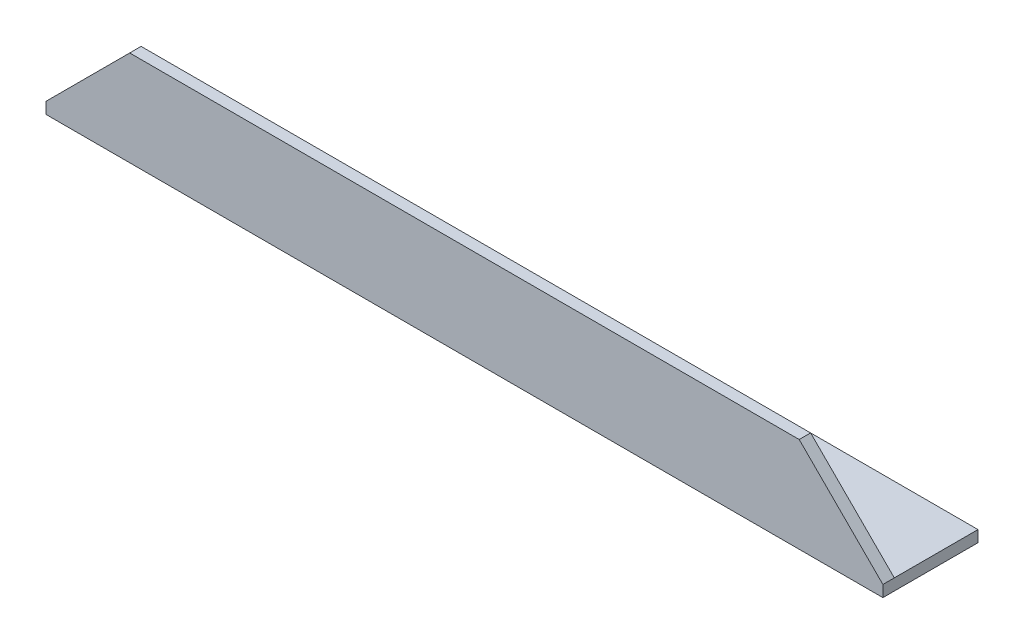
from build123d import *

# Parameters (mm, degrees)
EXTRUDE_1_DEPTH     = 220
SKETCH_2_OUTSIDE_W  = 266.564
SKETCH_2_OUTSIDE_H  = 71.564
CUT_EXTRUDE_1_DEPTH = 220


with BuildPart() as part:
    # Эскиз1 → Бобышка-Вытянуть1 (new body)
    with BuildSketch(Plane(origin=(0, 0, 0), x_dir=(0, 0, -1), z_dir=(1, 0, 0))):
        Polygon((0, 25), (0, 0), (25, 0), (25, 3), (3, 3), (3, 25), align=None)
    extrude(amount=EXTRUDE_1_DEPTH)

    # Эскиз2 outside → Вырез-Вытянуть1 (cut)
    with BuildSketch(Plane.XY):
        with Locations((110, 12.5)):
            Rectangle(SKETCH_2_OUTSIDE_W, SKETCH_2_OUTSIDE_H)
        Polygon((0, 0), (220, 0), (220, 3), (198, 25), (22, 25), (0, 3), align=None, mode=Mode.SUBTRACT)
    extrude(amount=-CUT_EXTRUDE_1_DEPTH, mode=Mode.SUBTRACT)


solid = part.part
